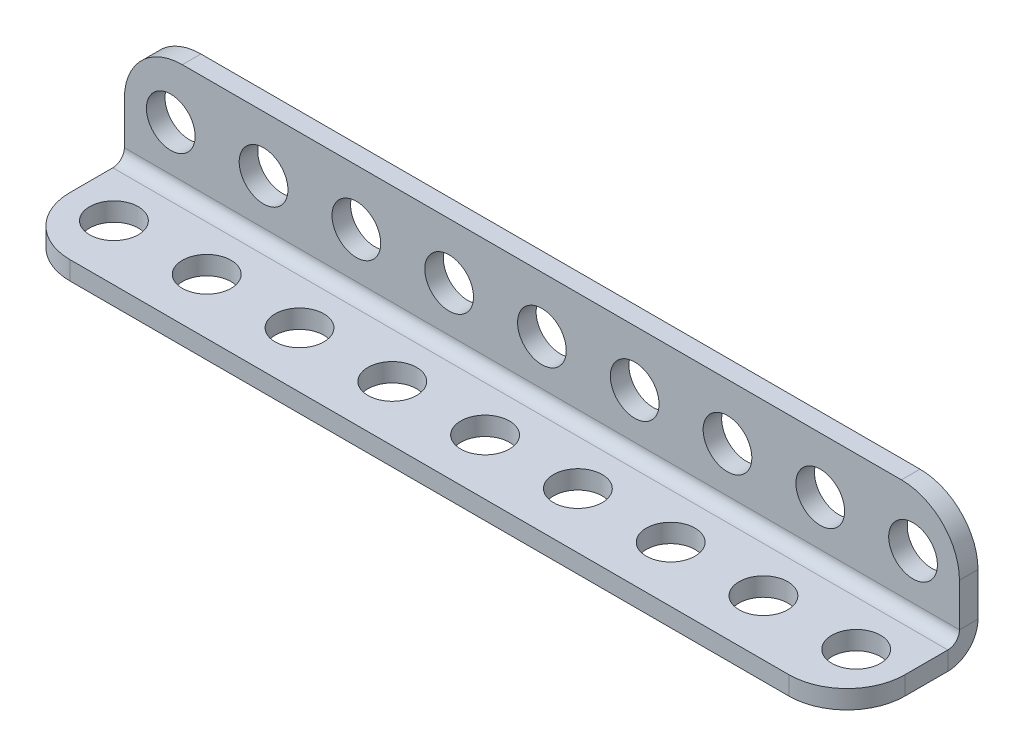
from build123d import *

# Parameters (mm, degrees)
BASE_FLANGE1_DEPTH = 72
FILLET1_R          = 5
SKETCH6_R          = 2.1
CUT_EXTRUDE1_DEPTH = 74.524009684
SKETCH7_R          = 2.1
CUT_EXTRUDE2_DEPTH = 74.524009684
LPATTERN1_COUNT    = 9
LPATTERN1_PITCH    = 8


# Sheet-metal steps are written as plain solids
with BuildPart() as part:
    # Sketch1 → Base-Flange1 (new body)
    with BuildSketch(Plane(origin=(0, 0, 0), x_dir=(0, 0, -1), z_dir=(1, 0, 0))):
        with BuildLine():
            Line((0, 11.3), (0, 2.6))
            ThreePointArc((0, 2.6), (-0.761522369, 0.761522369), (-2.6, 0))
            Line((-2.6, 0), (-11.3, 0))
            Line((-11.3, 0), (-11.3, 1.6))
            Line((-11.3, 1.6), (-2.6, 1.6))
            ThreePointArc((-2.6, 1.6), (-1.892893219, 1.892893219), (-1.6, 2.6))
            Line((-1.6, 2.6), (-1.6, 11.3))
            Line((-1.6, 11.3), (0, 11.3))
        make_face()
    extrude(amount=BASE_FLANGE1_DEPTH)

    # Fillet1
    fillet1_edges = [part.edges().sort_by_distance(p)[0] for p in [
        (72, 11.3, 0.8),
        (72, 0.8, 11.3),
        (0, 11.3, 0.8),
        (0, 0.8, 11.3),
    ]]
    fillet(fillet1_edges, radius=FILLET1_R)

    # Sketch6 → Cut-Extrude1 (cut, through all)
    with BuildSketch(Plane.XY.offset(1.6)):
        with Locations((4, 6.5)):
            Circle(SKETCH6_R)
    cut_extrude1 = extrude(amount=-CUT_EXTRUDE1_DEPTH, mode=Mode.SUBTRACT)

    # Sketch7 → Cut-Extrude2 (cut, through all)
    with BuildSketch(Plane(origin=(0, 1.6, 0), x_dir=(1, 0, 0), z_dir=(0, 1, 0))):
        with Locations(Location((4, -6.5, 0), (0, 0, 270))):
            Circle(SKETCH7_R)
    cut_extrude2 = extrude(amount=-CUT_EXTRUDE2_DEPTH, mode=Mode.SUBTRACT)

    # LPattern1: Cut-Extrude1, Cut-Extrude2 ×9
    with Locations(*[(i * LPATTERN1_PITCH, 0, 0) for i in range(1, LPATTERN1_COUNT)]):
        add(cut_extrude1, mode=Mode.SUBTRACT)
        add(cut_extrude2, mode=Mode.SUBTRACT)


solid = part.part
